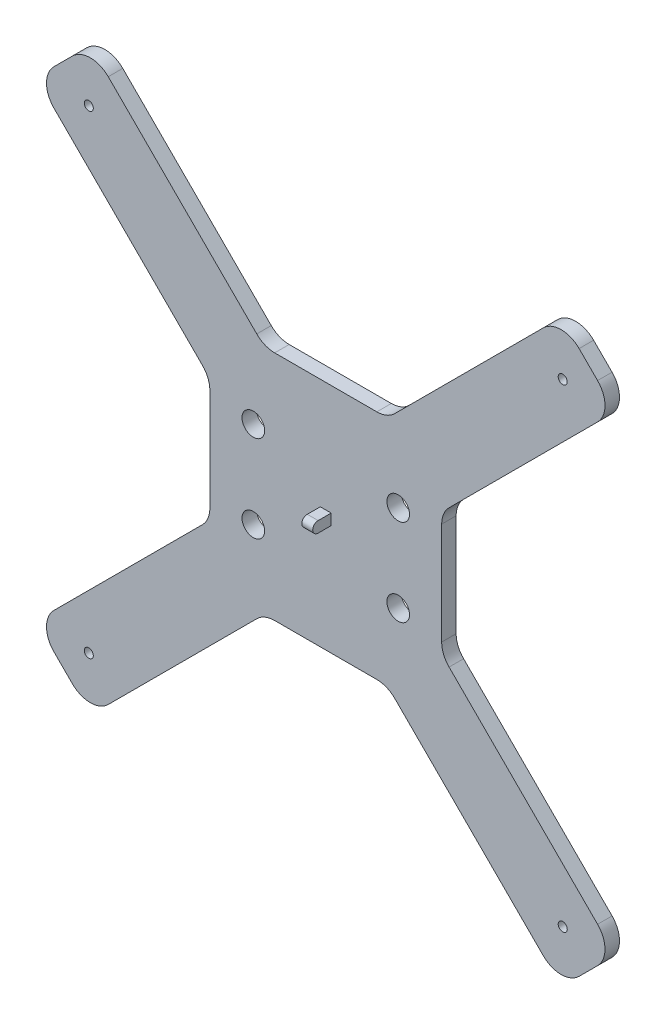
from build123d import *

# Parameters (mm, degrees)
BOSS_EXTRUDE1_DEPTH = 5.08
FILLET1_R           = 8.89
SKETCH2_R           = 3.96875
CUT_EXTRUDE1_DEPTH  = 283.206280731
SKETCH3_R           = 1.5875
CUT_EXTRUDE2_DEPTH  = 283.206280731
BOSS_EXTRUDE3_DEPTH = 1.905


with BuildPart() as part:
    # Sketch1 → Boss-Extrude1 (new body)
    with BuildSketch(Plane.XY):
        Polygon((0, 184.15), (60.96, 123.19), (60.96, 80.01), (0, 19.05), (19.05, 0), (80.01, 60.96), (123.19, 60.96), (184.15, 0), (203.2, 19.05), (142.24, 80.01), (142.24, 123.19), (203.2, 184.15), (184.15, 203.2), (123.19, 142.24), (80.01, 142.24), (19.05, 203.2), align=None)
    extrude(amount=BOSS_EXTRUDE1_DEPTH)

    # Fillet1
    fillet1_edges = [part.edges().sort_by_distance(p)[0] for p in [
        (60.96, 80.01, 2.54),
        (60.96, 123.19, 2.54),
        (0, 184.15, 2.54),
        (19.05, 203.2, 2.54),
        (80.01, 142.24, 2.54),
        (123.19, 142.24, 2.54),
        (184.15, 203.2, 2.54),
        (203.2, 184.15, 2.54),
        (142.24, 123.19, 2.54),
        (142.24, 80.01, 2.54),
        (203.2, 19.05, 2.54),
        (184.15, 0, 2.54),
        (123.19, 60.96, 2.54),
        (80.01, 60.96, 2.54),
        (0, 19.05, 2.54),
        (19.05, 0, 2.54),
    ]]
    fillet(fillet1_edges, radius=FILLET1_R)

    # Sketch2 → Cut-Extrude1 (cut, through all)
    with BuildSketch(Plane.XY.offset(5.08)):
        with Locations((127, 86.36)):
            Circle(SKETCH2_R)
        with Locations((127, 116.84)):
            Circle(SKETCH2_R)
        with Locations((76.2, 86.36)):
            Circle(SKETCH2_R)
        with Locations((76.2, 116.84)):
            Circle(SKETCH2_R)
    extrude(amount=-CUT_EXTRUDE1_DEPTH, mode=Mode.SUBTRACT)

    # Sketch3 → Cut-Extrude2 (cut, through all)
    with BuildSketch(Plane.XY.offset(5.08)):
        with Locations((184.688815367, 184.700672391)):
            Circle(SKETCH3_R)
        with Locations((18.511184633, 184.700672391)):
            Circle(SKETCH3_R)
        with Locations((18.511184633, 18.499327609)):
            Circle(SKETCH3_R)
        with Locations((184.688815367, 18.499327609)):
            Circle(SKETCH3_R)
    extrude(amount=-CUT_EXTRUDE2_DEPTH, mode=Mode.SUBTRACT)

    # Sketch5 → Boss-Extrude3 (add, symmetric)
    with BuildSketch(Plane(origin=(101.6, 0, 0), x_dir=(0, 0, -1), z_dir=(1, 0, 0))):
        with BuildLine():
            Line((-5.08, 99.695), (-5.08, 103.505))
            Line((-5.08, 103.505), (-9.652, 103.505))
            ThreePointArc((-9.652, 103.505), (-11.557, 101.6), (-9.652, 99.695))
            Line((-9.652, 99.695), (-5.08, 99.695))
        make_face()
    extrude(amount=BOSS_EXTRUDE3_DEPTH, both=True)


solid = part.part
